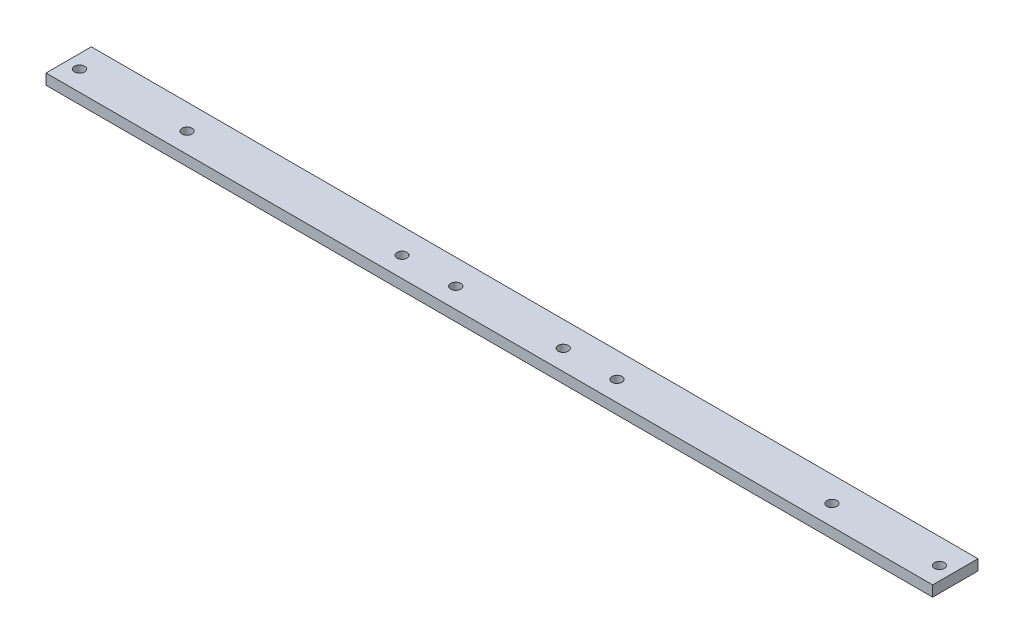
from build123d import *

# Parameters (mm, degrees)
SKETCH1_R           = 2
SKETCH1_R_2         = 1.5
BOSS_EXTRUDE1_DEPTH = 3.175
SKETCH2_R           = 1.5
CUT_EXTRUDE1_DEPTH  = 10
SKETCH3_W           = 264
SKETCH3_H           = 13.5
CUT_EXTRUDE2_DEPTH  = 10


with BuildPart() as part:
    # Sketch1 → Boss-Extrude1 (new body)
    with BuildSketch(Plane(origin=(0, 0, 0), x_dir=(1, 0, 0), z_dir=(0, 1, 0))):
        Polygon((0, 25.535634143), (0, -1.464365857), (264, -1.464365857), (264, 4.535634143), (264, 25.535634143), align=None)
        with Locations((132, 21.535634143)):
            Circle(SKETCH1_R, mode=Mode.SUBTRACT)
        with Locations((100, 21.535634143)):
            Circle(SKETCH1_R, mode=Mode.SUBTRACT)
        with Locations((68, 21.535634143)):
            Circle(SKETCH1_R, mode=Mode.SUBTRACT)
        with Locations((196, 21.535634143)):
            Circle(SKETCH1_R, mode=Mode.SUBTRACT)
        with Locations((164, 21.535634143)):
            Circle(SKETCH1_R, mode=Mode.SUBTRACT)
        with Locations((260, 4.535634143)):
            Circle(SKETCH1_R_2, mode=Mode.SUBTRACT)
        with Locations((36, 4.535634143)):
            Circle(SKETCH1_R_2, mode=Mode.SUBTRACT)
        with Locations((228, 4.535634143)):
            Circle(SKETCH1_R_2, mode=Mode.SUBTRACT)
        with Locations((4, 4.535634143)):
            Circle(SKETCH1_R_2, mode=Mode.SUBTRACT)
    extrude(amount=BOSS_EXTRUDE1_DEPTH)

    # Sketch2 → Cut-Extrude1 (cut)
    with BuildSketch(Plane(origin=(0, 3.175, 0), x_dir=(1, 0, 0), z_dir=(0, 1, 0))):
        with Locations((116, 4.535634143)):
            Circle(SKETCH2_R)
        with Locations((148, 4.535634143)):
            Circle(SKETCH2_R)
        with Locations((100, 4.535634143)):
            Circle(SKETCH2_R)
        with Locations((164, 4.535634143)):
            Circle(SKETCH2_R)
    extrude(amount=-CUT_EXTRUDE1_DEPTH, mode=Mode.SUBTRACT)

    # Sketch3 → Cut-Extrude2 (cut)
    with BuildSketch(Plane(origin=(0, 3.175, 0), x_dir=(1, 0, 0), z_dir=(0, 1, 0))):
        with Locations((132, 18.785634143)):
            Rectangle(SKETCH3_W, SKETCH3_H)
    extrude(amount=-CUT_EXTRUDE2_DEPTH, mode=Mode.SUBTRACT)


solid = part.part
